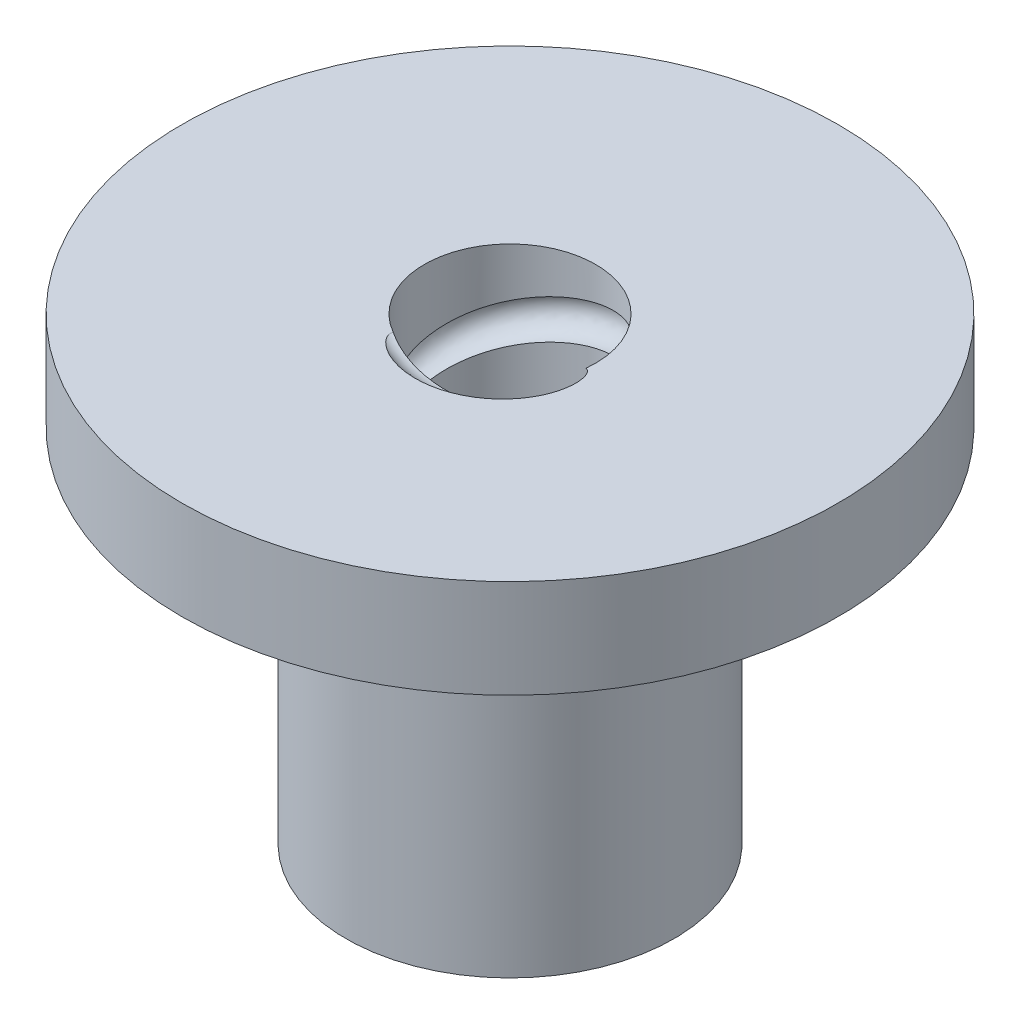
from build123d import *

# Parameters (mm, degrees)
SKETCH1_R           = 50
BOSS_EXTRUDE1_DEPTH = 15
SKETCH2_R           = 25
BOSS_EXTRUDE2_DEPTH = 55
SKETCH3_R           = 13.05
CUT_EXTRUDE1_DEPTH  = 55
CUT_SWEEP2_PITCH    = 19.05


with BuildPart() as part:
    # Sketch1 → Boss-Extrude1 (new body)
    with BuildSketch(Plane(origin=(0, 0, 0), x_dir=(1, 0, 0), z_dir=(0, 1, 0))):
        with Locations(Location((0, 0, 0), (0, 0, 270))):
            Circle(SKETCH1_R)
    extrude(amount=BOSS_EXTRUDE1_DEPTH)

    # Sketch2 → Boss-Extrude2 (add)
    with BuildSketch(Plane.XZ):
        with Locations(Location((0, 0, 0), (0, 0, 270))):
            Circle(SKETCH2_R)
    extrude(amount=BOSS_EXTRUDE2_DEPTH)

    # Sketch3 → Cut-Extrude1 (cut)
    with BuildSketch(Plane(origin=(0, 15, 0), x_dir=(1, 0, 0), z_dir=(0, 1, 0))):
        with Locations(Location((0, 0, 0), (0, 0, 270))):
            Circle(SKETCH3_R)
    extrude(amount=-CUT_EXTRUDE1_DEPTH, mode=Mode.SUBTRACT)

    # Cut-Sweep2: arcs per turn and ends read off the stored shape
    # Cut-Sweep2: the profile of Sketch6 screwed along a left-hand helix through 5.5 turns, 20 arcs to a turn; built about Z, then put on its axis
    cut_sweep2_z = Axis((0, 0, 0), (0, 0, 1))
    cut_sweep2_corners = [(10.05, 0, -19.05), (13.05, 0, -16.05), (16.05, 0, -19.05), (13.05, 0, -22.05)]
    with BuildLine(mode=Mode.PRIVATE) as cut_sweep2_profile:
        ThreePointArc((10.05, 0, -19.05), (10.928679656, 0, -16.928679656), (13.05, 0, -16.05))
        ThreePointArc((13.05, 0, -16.05), (15.171320344, 0, -16.928679656), (16.05, 0, -19.05))
        ThreePointArc((16.05, 0, -19.05), (15.171320344, 0, -21.171320344), (13.05, 0, -22.05))
        ThreePointArc((13.05, 0, -22.05), (10.928679656, 0, -21.171320344), (10.05, 0, -19.05))
    cut_sweep2_cap = Face(cut_sweep2_profile.wire())
    cut_sweep2_arcs = [((10.05, 0, -19.05), (10.05, 0, -16.05), (13.05, 0, -16.05), (1, 0.7071067811865476, 1)), ((13.05, 0, -16.05), (16.05, 0, -16.05), (16.05, 0, -19.05), (1, 0.7071067811865476, 1)), ((16.05, 0, -19.05), (16.05, 0, -22.05), (13.05, 0, -22.05), (1, 0.7071067811865476, 1)), ((13.05, 0, -22.05), (10.05, 0, -22.05), (10.05, 0, -19.05), (1, 0.7071067811865476, 1))]  # start, shoulder, end, weights
    cut_sweep2_turn_angles = [0, -9, -18, -27, -36, -45, -54, -63, -72, -81, -90, -99, -108, -117, -126, -135, -144, -153, -162, -171, -180, -189, -198, -207, -216, -225, -234, -243, -252, -261, -270, -279, -288, -297, -306, -315, -324, -333, -342, -351, -360]
    cut_sweep2_turn_weights = [1, 0.9876883405951378, 1, 0.9876883405951378, 1, 0.9876883405951378, 1, 0.9876883405951378, 1, 0.9876883405951378, 1, 0.9876883405951378, 1, 0.9876883405951378, 1, 0.9876883405951378, 1, 0.9876883405951378, 1, 0.9876883405951378, 1, 0.9876883405951378, 1, 0.9876883405951378, 1, 0.9876883405951378, 1, 0.9876883405951378, 1, 0.9876883405951378, 1, 0.9876883405951378, 1, 0.9876883405951378, 1, 0.9876883405951378, 1, 0.9876883405951378, 1, 0.9876883405951378, 1]
    cut_sweep2_turn_sides = [Face.make_bezier_surface([[Vector(p[j][0], p[j][1], 0).rotate(cut_sweep2_z, cut_sweep2_turn_angles[2 * i + k]) / cut_sweep2_turn_weights[2 * i + k] + Vector(0, 0, p[j][2] + -CUT_SWEEP2_PITCH * cut_sweep2_turn_angles[2 * i + k] / 360) for k in range(3)] for j in range(3)], [[p[3][j] * cut_sweep2_turn_weights[2 * i + k] for k in range(3)] for j in range(3)]) for p in cut_sweep2_arcs for i in range(20)]
    cut_sweep2_last_angles = [-1800, -1809, -1818, -1827, -1836, -1845, -1854, -1863, -1872, -1881, -1890, -1899, -1908, -1917, -1926, -1935, -1944, -1953, -1962, -1971, -1980]
    cut_sweep2_last_weights = [1, 0.9876883405951378, 1, 0.9876883405951378, 1, 0.9876883405951378, 1, 0.9876883405951378, 1, 0.9876883405951378, 1, 0.9876883405951378, 1, 0.9876883405951378, 1, 0.9876883405951378, 1, 0.9876883405951378, 1, 0.9876883405951378, 1]
    cut_sweep2_last_sides = [Face.make_bezier_surface([[Vector(p[j][0], p[j][1], 0).rotate(cut_sweep2_z, cut_sweep2_last_angles[2 * i + k]) / cut_sweep2_last_weights[2 * i + k] + Vector(0, 0, p[j][2] + -CUT_SWEEP2_PITCH * cut_sweep2_last_angles[2 * i + k] / 360) for k in range(3)] for j in range(3)], [[p[3][j] * cut_sweep2_last_weights[2 * i + k] for k in range(3)] for j in range(3)]) for p in cut_sweep2_arcs for i in range(10)]
    cut_sweep2 = Plane(origin=(0, -55, 0), x_dir=(-1, 0, 0), z_dir=(0, 1, 0)) * Solid(Shell([*[p.moved(Location((0, 0, CUT_SWEEP2_PITCH * i))) for i in range(5) for p in cut_sweep2_turn_sides], *cut_sweep2_last_sides, cut_sweep2_cap, cut_sweep2_cap.rotate(cut_sweep2_z, -1980).moved(Location((0, 0, -CUT_SWEEP2_PITCH * -1980 / 360)))]))
    add(cut_sweep2, mode=Mode.SUBTRACT)


solid = part.part
